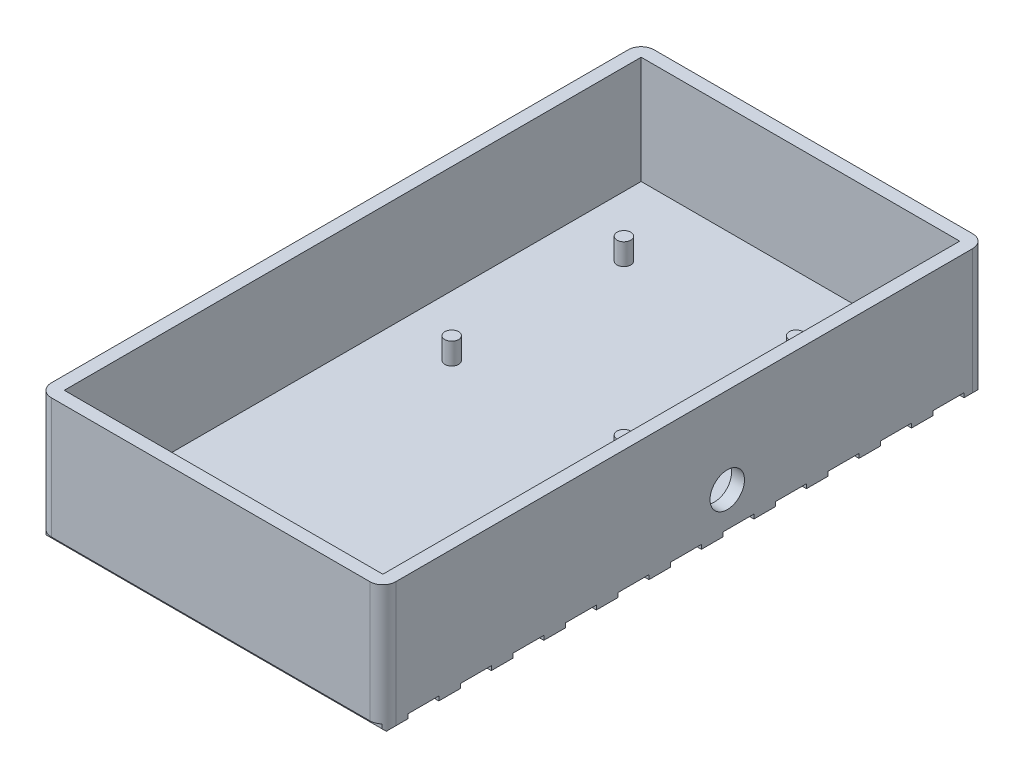
from build123d import *

# Parameters (mm, degrees)
SKETCH1_W           = 80
SKETCH1_H           = 140
BOSS_EXTRUDE1_DEPTH = 3
SKETCH2_W           = 80
SKETCH2_H           = 140
SKETCH2_W_2         = 74
SKETCH2_H_2         = 134
BOSS_EXTRUDE2_DEPTH = 25
SKETCH3_R           = 1.6
BOSS_EXTRUDE3_DEPTH = 5
SKETCH4_W           = 80
SKETCH4_H           = 5
BOSS_EXTRUDE4_DEPTH = 2
CHAMFER1_SIZE       = 1
SKETCH5_R           = 4
CUT_EXTRUDE1_DEPTH  = 10
FILLET1_R           = 3


with BuildPart() as part:
    # Sketch1 → Boss-Extrude1 (new body)
    with BuildSketch(Plane(origin=(0, 0, 0), x_dir=(1, 0, 0), z_dir=(0, 1, 0))):
        Rectangle(SKETCH1_W, SKETCH1_H)
    extrude(amount=BOSS_EXTRUDE1_DEPTH)

    # Sketch2 → Boss-Extrude2 (add)
    with BuildSketch(Plane(origin=(0, 3, 0), x_dir=(1, 0, 0), z_dir=(0, 1, 0))):
        Rectangle(SKETCH2_W, SKETCH2_H)
        Rectangle(SKETCH2_W_2, SKETCH2_H_2, mode=Mode.SUBTRACT)
    extrude(amount=BOSS_EXTRUDE2_DEPTH)

    # Sketch3 → Boss-Extrude3 (add)
    with BuildSketch(Plane(origin=(0, 3, 0), x_dir=(1, 0, 0), z_dir=(0, 1, 0))):
        with Locations(Location((-23, 49, 0), (0, 0, 270))):
            Circle(SKETCH3_R)
        with Locations(Location((-23, 9, 0), (0, 0, 270))):
            Circle(SKETCH3_R)
        with Locations(Location((17, 9, 0), (0, 0, 90))):
            Circle(SKETCH3_R)
        with Locations(Location((17, 49, 0), (0, 0, 90))):
            Circle(SKETCH3_R)
    extrude(amount=BOSS_EXTRUDE3_DEPTH)

    # Sketch4 → Boss-Extrude4 (add)
    with BuildSketch(Plane.XZ):
        with Locations((0, -67.5)):
            Rectangle(SKETCH4_W, SKETCH4_H)
        with Locations((0, -55.3)):
            Rectangle(SKETCH4_W, SKETCH4_H)
        with Locations((0, -43.1)):
            Rectangle(SKETCH4_W, SKETCH4_H)
        with Locations((0, -30.9)):
            Rectangle(SKETCH4_W, SKETCH4_H)
        with Locations((0, -18.7)):
            Rectangle(SKETCH4_W, SKETCH4_H)
        with Locations((0, -6.5)):
            Rectangle(SKETCH4_W, SKETCH4_H)
        with Locations((0, 5.7)):
            Rectangle(SKETCH4_W, SKETCH4_H)
        with Locations((0, 17.9)):
            Rectangle(SKETCH4_W, SKETCH4_H)
        with Locations((0, 30.1)):
            Rectangle(SKETCH4_W, SKETCH4_H)
        with Locations((0, 42.3)):
            Rectangle(SKETCH4_W, SKETCH4_H)
        with Locations((0, 54.5)):
            Rectangle(SKETCH4_W, SKETCH4_H)
        with Locations((0, 66.7)):
            Rectangle(SKETCH4_W, SKETCH4_H)
    extrude(amount=BOSS_EXTRUDE4_DEPTH)

    # Chamfer1
    chamfer1_edges = [part.edges().sort_by_distance(p)[0] for p in [
        (0, -2, -16.2),
        (-40, -2, -6.5),
        (0, -2, -9),
        (40, -2, -6.5),
        (0, -2, -4),
        (-40, -2, 5.7),
        (0, -2, 3.2),
        (40, -2, 5.7),
        (0, -2, 8.2),
        (-40, -2, 17.9),
        (0, -2, 15.4),
        (40, -2, 17.9),
        (0, -2, 20.4),
        (-40, -2, 30.1),
        (0, -2, 27.6),
        (40, -2, 30.1),
        (0, -2, 32.6),
        (-40, -2, 42.3),
        (0, -2, 39.8),
        (40, -2, 42.3),
        (0, -2, 44.8),
        (-40, -2, 54.5),
        (0, -2, 52),
        (40, -2, 54.5),
        (0, -2, 57),
        (-40, -2, 66.7),
        (0, -2, 64.2),
        (40, -2, 66.7),
        (0, -2, 69.2),
        (-40, -2, -67.5),
        (0, -2, -70),
        (40, -2, -67.5),
        (0, -2, -65),
        (-40, -2, -55.3),
        (0, -2, -57.8),
        (40, -2, -55.3),
        (0, -2, -52.8),
        (-40, -2, -43.1),
        (0, -2, -45.6),
        (40, -2, -43.1),
        (0, -2, -40.6),
        (-40, -2, -30.9),
        (0, -2, -33.4),
        (40, -2, -30.9),
        (0, -2, -28.4),
        (-40, -2, -18.7),
        (0, -2, -21.2),
        (40, -2, -18.7),
    ]]
    chamfer(chamfer1_edges, length=CHAMFER1_SIZE)

    # Sketch5 → Cut-Extrude1 (cut)
    with BuildSketch(Plane(origin=(40, 0, 0), x_dir=(0, 0, -1), z_dir=(1, 0, 0))):
        with Locations((10, 8)):
            Circle(SKETCH5_R)
    extrude(amount=-CUT_EXTRUDE1_DEPTH, mode=Mode.SUBTRACT)

    # Fillet1
    # the kernel refuses this fillet: 3 mm, written as the material it takes off along each edge
    with BuildSketch(Plane(origin=(40, 35.5, 70), x_dir=(0, 0, -1), z_dir=(0, -1, 0)), Plane(origin=(-40, -7.5, 70), x_dir=(0, 0, -1), z_dir=(0, 1, 0))) as fillet1_piece_1:
        with BuildLine():
            CenterArc((FILLET1_R, -FILLET1_R), FILLET1_R, 90, 90)
            Line((0, -FILLET1_R), (0, 0))
            Line((0, 0), (FILLET1_R, 0))
        make_face()
    extrude(amount=43, mode=Mode.SUBTRACT)
    with BuildSketch(Plane(origin=(40, 35.5, -70), x_dir=(-1, 0, 0), z_dir=(0, -1, 0)), Plane(origin=(-40, -8.5, -70), x_dir=(1, 0, 0), z_dir=(0, 1, 0))) as fillet1_piece_2:
        with BuildLine():
            CenterArc((FILLET1_R, -FILLET1_R), FILLET1_R, 90, 90)
            Line((0, -FILLET1_R), (0, 0))
            Line((0, 0), (FILLET1_R, 0))
        make_face()
    extrude(amount=44, mode=Mode.SUBTRACT)


solid = part.part
